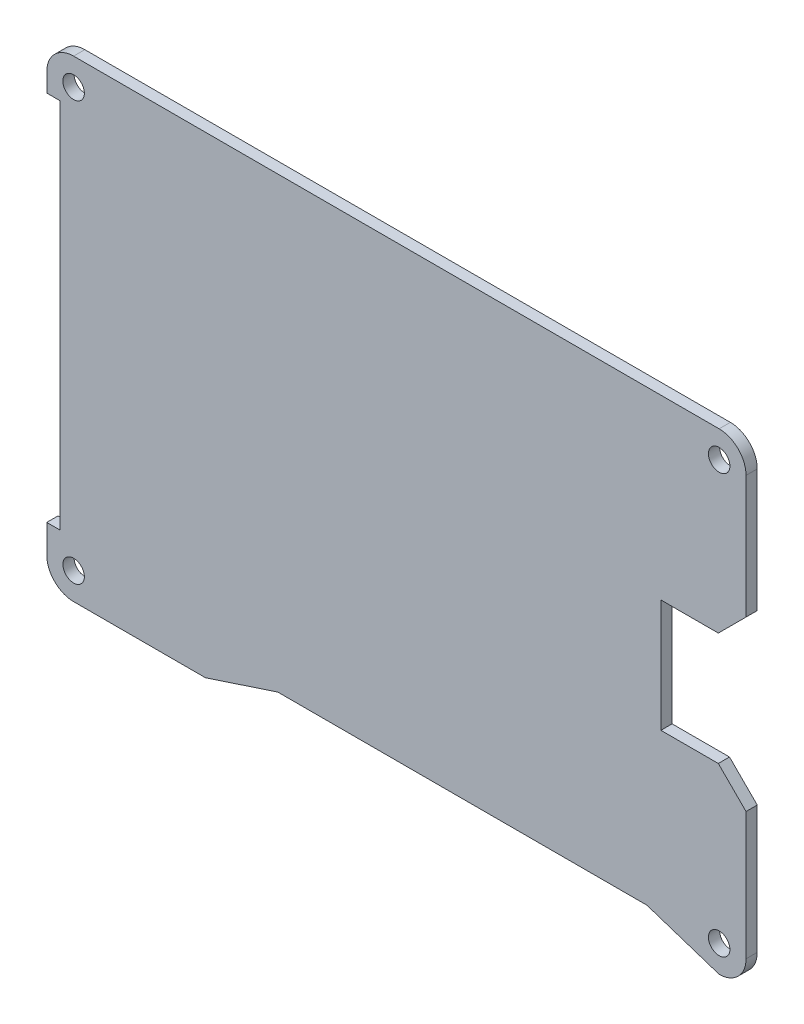
from build123d import *

# Parameters (mm, degrees)
SKETCH1_R           = 1.524
BOSS_EXTRUDE1_DEPTH = 1.5875


with BuildPart() as part:
    # Sketch1 → Boss-Extrude1 (new body)
    with BuildSketch(Plane.XY):
        with BuildLine():
            Line((-301.9473, 133.57775), (-305.87795, 129.6471))
            Line((-305.87795, 129.6471), (-314.0123, 129.6471))
            Line((-314.0123, 129.6471), (-314.0123, 113.6451))
            Line((-314.0123, 113.6451), (-305.87795, 113.6451))
            Line((-305.87795, 113.6451), (-301.9473, 109.71445))
            Line((-301.9473, 109.71445), (-301.9473, 91.6317))
            ThreePointArc((-301.9473, 91.6317), (-303.063223164, 88.937623164), (-305.7573, 87.8217))
            Line((-305.7573, 87.8217), (-315.9973, 91.1883))
            Line((-315.9973, 91.1883), (-368.3165, 91.1883))
            Line((-368.3165, 91.1883), (-378.5565, 87.8217))
            Line((-378.5565, 87.8217), (-397.2472, 87.8217))
            ThreePointArc((-397.2472, 87.8217), (-399.951018769, 88.947400452), (-401.0571, 91.659304166))
            Line((-401.0571, 91.659304166), (-401.0571, 95.6449))
            Line((-401.0571, 95.6449), (-399.1521, 95.6449))
            Line((-399.1521, 95.6449), (-399.1521, 148.341))
            Line((-399.1521, 148.341), (-401.0571, 148.341))
            Line((-401.0571, 148.341), (-401.0571, 150.956597849))
            ThreePointArc((-401.0571, 150.956597849), (-399.946077222, 153.659592612), (-397.247125, 154.7804))
            Line((-397.247125, 154.7804), (-305.7573, 154.7804))
            ThreePointArc((-305.7573, 154.7804), (-303.063223164, 153.664476836), (-301.9473, 150.9704))
            Line((-301.9473, 150.9704), (-301.9473, 133.57775))
        make_face()
        with Locations((-305.7573, 150.9704)):
            Circle(SKETCH1_R, mode=Mode.SUBTRACT)
        with Locations((-397.247125, 150.9704)):
            Circle(SKETCH1_R, mode=Mode.SUBTRACT)
        with Locations((-397.2472, 91.6317)):
            Circle(SKETCH1_R, mode=Mode.SUBTRACT)
        with Locations((-305.7573, 91.6317)):
            Circle(SKETCH1_R, mode=Mode.SUBTRACT)
    extrude(amount=BOSS_EXTRUDE1_DEPTH)


solid = part.part
